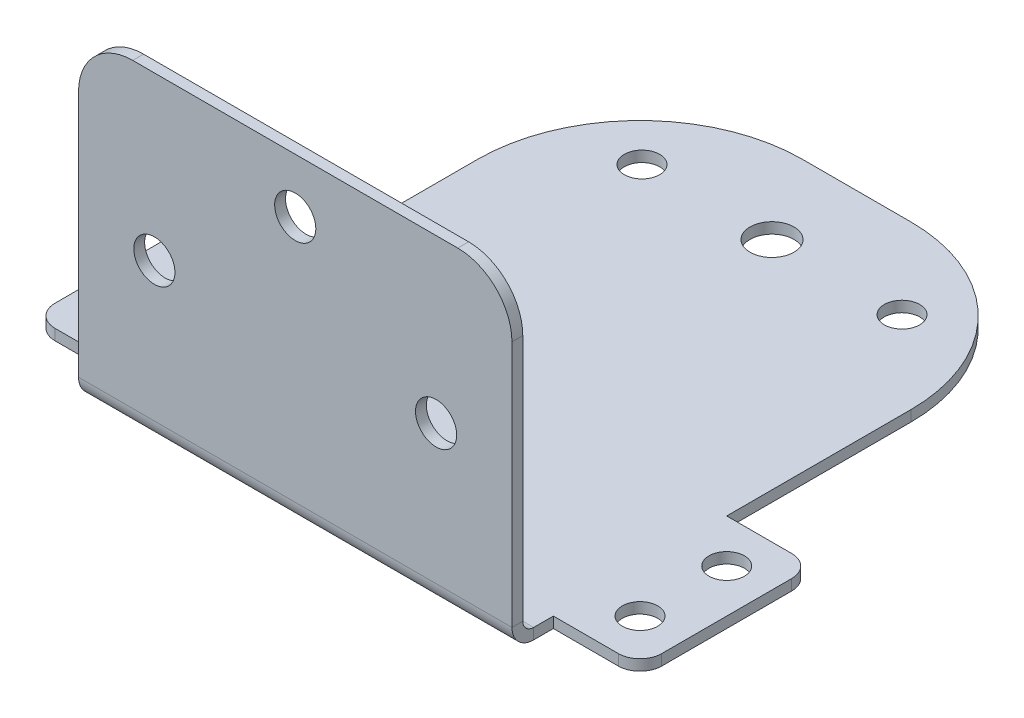
from build123d import *

# Parameters (mm, degrees)
BASE_FLANGE1_DEPTH       = 1
SKETCHED_START           = 11.616422755
SKETCHED_BEND1_OUTLINE_W = 40
SKETCHED_BEND1_OUTLINE_H = 1
SKETCHED_BEND1_DEPTH     = 28.383577245
SKETCHED_START_2         = 10.821902755
SKETCHED_BEND1_2_DEPTH   = 0.00548
SKETCHED_START_3         = 9.821902755
SKETCHED_BEND1_3_DEPTH   = 2
SKETCHED_START_4         = -20
SKETCHED_BEND1_4_DEPTH   = 40
SKETCH7_R                = 2.025
CUT_EXTRUDE1_DEPTH       = 10
F_6_CLEARANCE_HOLE1_D    = 3.7973
F_4_CLEARANCE_HOLE2_D    = 3.2639


with BuildPart() as part:
    # Base-Flange1: sheet metal written as solids
    # Sketch1 → Base-Flange1 (new body)
    with BuildSketch(Plane(origin=(0, 0, 0), x_dir=(1, 0, 0), z_dir=(0, 1, 0))):
        with BuildLine():
            Line((-20, -8), (-20, -35))
            ThreePointArc((-20, -35), (-18.535533906, -38.535533906), (-15, -40))
            Line((-15, -40), (15, -40))
            ThreePointArc((15, -40), (18.535533906, -38.535533906), (20, -35))
            Line((20, -35), (20, -8))
            Line((20, -8), (26, -8))
            ThreePointArc((26, -8), (27.414213562, -7.414213562), (28, -6))
            Line((28, -6), (28, 6))
            ThreePointArc((28, 6), (27.414213562, 7.414213562), (26, 8))
            Line((26, 8), (20, 8))
            Line((20, 8), (20, 25))
            ThreePointArc((20, 25), (15.606601718, 35.606601718), (5, 40))
            Line((5, 40), (-5, 40))
            ThreePointArc((-5, 40), (-15.606601718, 35.606601718), (-20, 25))
            Line((-20, 25), (-20, 8))
            Line((-20, 8), (-26, 8))
            ThreePointArc((-26, 8), (-27.414213562, 7.414213562), (-28, 6))
            Line((-28, 6), (-28, -6))
            ThreePointArc((-28, -6), (-27.414213562, -7.414213562), (-26, -8))
            Line((-26, -8), (-20, -8))
        make_face()
    extrude(amount=-BASE_FLANGE1_DEPTH)

    # Sketched Bend1: read off the stored shape, not the designer's step
    # Sketched Bend1 outline → Sketched Bend1 (cut)
    with BuildSketch(Plane.XY.offset(SKETCHED_START)):
        with Locations((0, -0.5)):
            Rectangle(SKETCHED_BEND1_OUTLINE_W, SKETCHED_BEND1_OUTLINE_H)
    extrude(amount=SKETCHED_BEND1_DEPTH, mode=Mode.SUBTRACT)

    # Sketched Bend1 2 outline → Sketched Bend1 2 (add)
    with BuildSketch(Plane.XY.offset(SKETCHED_START_2)):
        with BuildLine():
            Line((20, 0), (20, 23.821902755))
            ThreePointArc((20, 23.821902755), (18.535533906, 27.357436661), (15, 28.821902755))
            Line((15, 28.821902755), (-15, 28.821902755))
            ThreePointArc((-15, 28.821902755), (-18.535533906, 27.357436661), (-20, 23.821902755))
            Line((-20, 23.821902755), (-20, 0))
            Line((-20, 0), (20, 0))
        make_face()
    extrude(amount=SKETCHED_BEND1_2_DEPTH)

    # Sketched Bend1 3 outline → Sketched Bend1 3 (add)
    with BuildSketch(Plane.XY.offset(SKETCHED_START_3)):
        with BuildLine():
            Line((20, 0), (20, 23.821902755))
            ThreePointArc((20, 23.821902755), (18.535533906, 27.357436661), (15, 28.821902755))
            Line((15, 28.821902755), (-15, 28.821902755))
            ThreePointArc((-15, 28.821902755), (-18.535533906, 27.357436661), (-20, 23.821902755))
            Line((-20, 23.821902755), (-20, 0))
            Line((-20, 0), (20, 0))
        make_face()
    extrude(amount=SKETCHED_BEND1_3_DEPTH)

    # Sketched Bend1 4 outline → Sketched Bend1 4 (cut)
    with BuildSketch(Plane.YZ.offset(SKETCHED_START_4)):
        with BuildLine():
            Line((28.821902755, 9.821902755), (28.821902755, 10.821902755))
            Line((28.821902755, 10.821902755), (1, 10.821902755))
            ThreePointArc((1, 10.821902755), (0.292893219, 10.529009536), (0, 9.821902755))
            Line((0, 9.821902755), (28.821902755, 9.821902755))
        make_face()
        with BuildLine():
            ThreePointArc((-1, 9.821902755), (-0.414213562, 11.236116317), (1, 11.821902755))
            Line((1, 11.821902755), (0, 11.821902755))
            Line((0, 11.821902755), (0, 11.616422755))
            Line((0, 11.616422755), (-1, 11.616422755))
            Line((-1, 11.616422755), (-1, 9.821902755))
        make_face()
    extrude(amount=SKETCHED_BEND1_4_DEPTH, mode=Mode.SUBTRACT)

    # Sketch7 → Cut-Extrude1 (cut)
    with BuildSketch(Plane(origin=(0, 0, 0), x_dir=(1, 0, 0), z_dir=(0, 1, 0))):
        with Locations(Location((0, 32.178097245, 0), (0, 0, 270))):
            Circle(SKETCH7_R)
    extrude(amount=-CUT_EXTRUDE1_DEPTH, mode=Mode.SUBTRACT)

    # #6 Clearance Hole1 (through all)
    with Locations(Plane(origin=(0, 0, 10.821902755), x_dir=(-1, 0, 0), z_dir=(0, 0, -1))):
        with Locations((13, 13.821902755), (-13, 13.821902755), (0, 23.821902755)):
            Hole(F_6_CLEARANCE_HOLE1_D / 2)

    # #4 Clearance Hole2 (through all)
    with Locations(Plane(origin=(0, 0, 0), x_dir=(1, 0, 0), z_dir=(0, 1, 0))):
        with Locations((-24, 4), (-24, -4), (24, 4), (24, -4), (-12, 32.178097245), (12, 32.178097245)):
            Hole(F_4_CLEARANCE_HOLE2_D / 2)


solid = part.part
